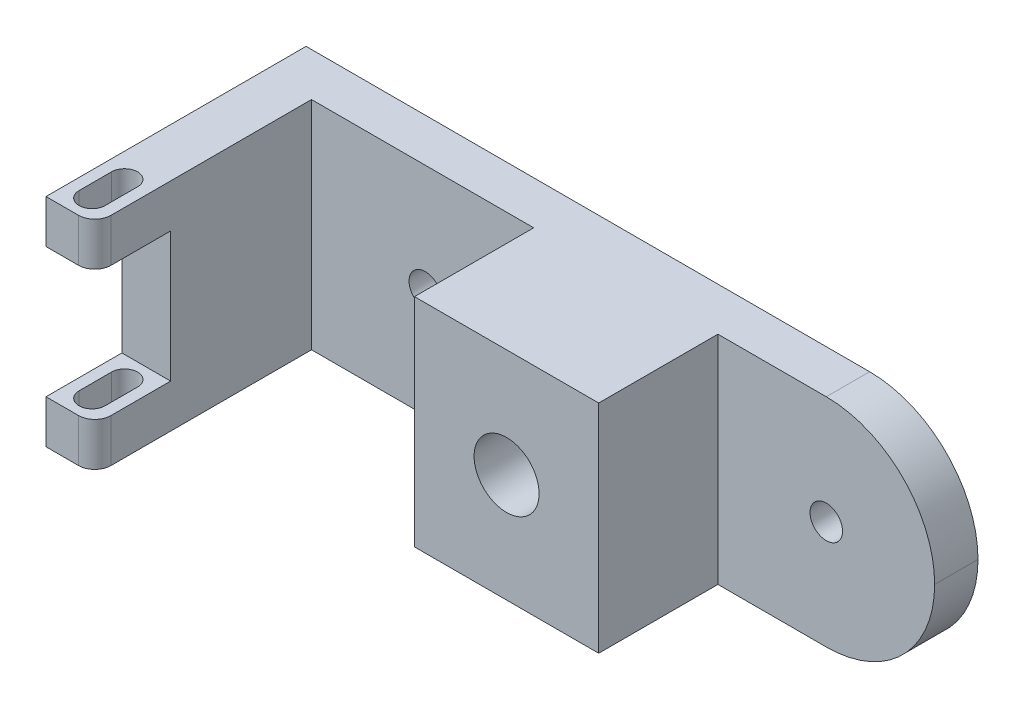
from build123d import *

# Parameters (mm, degrees)
SKETCH_1_W          = 57
SKETCH_1_H          = 20
SKETCH_1_R          = 1.5
EXTRUDE_1_DEPTH     = 4
FILLET_1_R          = 10
SKETCH_4_W          = 17
SKETCH_4_H          = 20
EXTRUDE_3_DEPTH     = 11
SKETCH_5_R          = 3
CUT_EXTRUDE_1_DEPTH = 9
SKETCH_6_R          = 1.5
CUT_EXTRUDE_2_DEPTH = 6
SKETCH_7_W          = 4
SKETCH_7_H          = 20
EXTRUDE_4_DEPTH     = 5
SKETCH_8_W          = 4.5
SKETCH_8_H          = 20
EXTRUDE_5_DEPTH     = 13
SKETCH_9_W          = 4.5
SKETCH_9_H          = 4
EXTRUDE_6_DEPTH     = 7
CUT_EXTRUDE_START   = -20
CUT_EXTRUDE_3_DEPTH = 20
FILLET_2_R          = 1.5


with BuildPart() as part:
    # 草图1 → 凸台-拉伸1 (new body)
    with BuildSketch(Plane.XY):
        Rectangle(SKETCH_1_W, SKETCH_1_H)
        with Locations((-18.5, 0)):
            Circle(SKETCH_1_R, mode=Mode.SUBTRACT)
        with Locations((18.5, 0)):
            Circle(SKETCH_1_R, mode=Mode.SUBTRACT)
    extrude(amount=EXTRUDE_1_DEPTH)

    # 圆角1
    fillet_1_edges = [part.edges().sort_by_distance(p)[0] for p in [
        (28.5, -10, 2),
        (28.5, 10, 2),
    ]]
    fillet(fillet_1_edges, radius=FILLET_1_R - 0.0001)  # a hair under: the kernel refuses the full size

    # 草图4 → 凸台-拉伸3 (add)
    with BuildSketch(Plane.XY.offset(4)):
        Rectangle(SKETCH_4_W, SKETCH_4_H)
    extrude(amount=EXTRUDE_3_DEPTH)

    # 草图5 → 切除-拉伸1 (cut)
    with BuildSketch(Plane.XY.offset(15)):
        Circle(SKETCH_5_R)
    extrude(amount=-CUT_EXTRUDE_1_DEPTH, mode=Mode.SUBTRACT)

    # 草图6 → 切除-拉伸2 (cut)
    with BuildSketch(Plane.XY.offset(6)):
        Circle(SKETCH_6_R)
    extrude(amount=-CUT_EXTRUDE_2_DEPTH, mode=Mode.SUBTRACT)

    # 草图7 → 凸台-拉伸4 (add)
    with BuildSketch(Plane.ZY.offset(28.5)):
        with Locations((2, 0)):
            Rectangle(SKETCH_7_W, SKETCH_7_H)
    extrude(amount=EXTRUDE_4_DEPTH)

    # 草图8 → 凸台-拉伸5 (add)
    with BuildSketch(Plane.XY.offset(4)):
        with Locations((-31.25, 0)):
            Rectangle(SKETCH_8_W, SKETCH_8_H)
    extrude(amount=EXTRUDE_5_DEPTH)

    # 草图9 → 凸台-拉伸6 (add)
    with BuildSketch(Plane.XY.offset(17)):
        with Locations((-31.25, 8)):
            Rectangle(SKETCH_9_W, SKETCH_9_H)
        with Locations((-31.25, -8)):
            Rectangle(SKETCH_9_W, SKETCH_9_H)
    extrude(amount=EXTRUDE_6_DEPTH)

    # 草图10 → 切除-拉伸3 (cut)
    with BuildSketch(Plane(origin=(0, 10, 0), x_dir=(1, 0, 0), z_dir=(0, 1, 0)).offset(CUT_EXTRUDE_START)):
        with BuildLine():
            Line((-32.45, -22), (-32.45, -19))
            ThreePointArc((-32.45, -19), (-31.25, -17.8), (-30.05, -19))
            Line((-30.05, -19), (-30.05, -22))
            ThreePointArc((-30.05, -22), (-31.25, -23.2), (-32.45, -22))
        make_face()
    extrude(amount=CUT_EXTRUDE_3_DEPTH, mode=Mode.SUBTRACT)

    # 圆角2
    fillet_2_edges = [part.edges().sort_by_distance(p)[0] for p in [
        (-29, 8, 24),
        (-29, -8, 24),
    ]]
    fillet(fillet_2_edges, radius=FILLET_2_R)


solid = part.part
